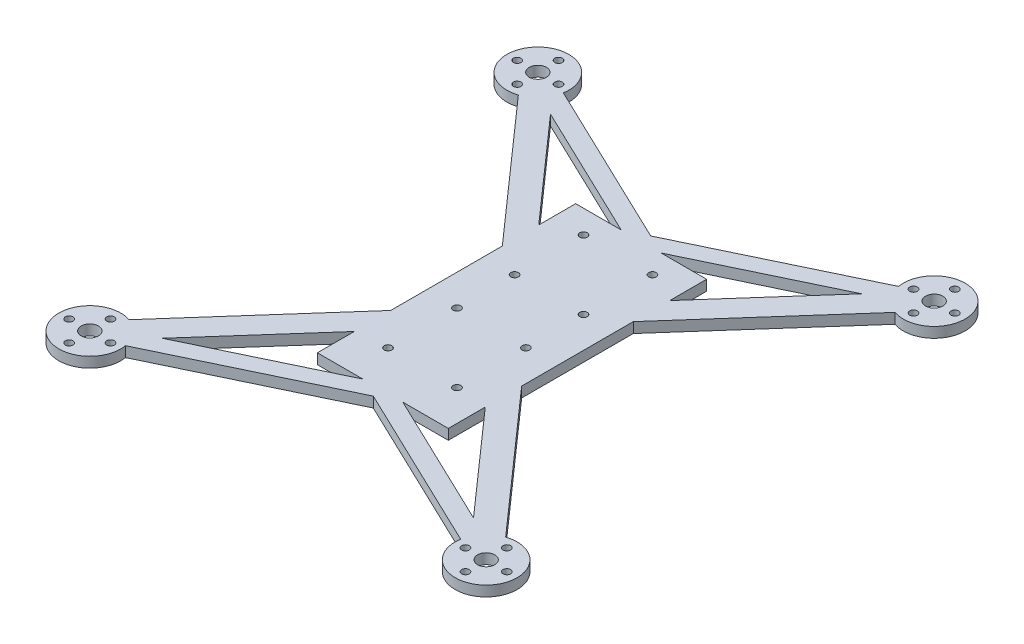
from build123d import *

# Parameters (mm, degrees)
SKETCH1_R           = 9
SKETCH1_R_2         = 1.1
SKETCH1_R_3         = 2.5
SKETCH1_W           = 38
SKETCH1_H           = 74.95
BOSS_EXTRUDE1_DEPTH = 3


with BuildPart() as part:
    # Sketch1 → Boss-Extrude1 (new body)
    # profile 1 of 13: a face of its own
    with BuildSketch(Plane(origin=(0, 0, 0), x_dir=(1, 0, 0), z_dir=(0, 1, 0))):
        with Locations((-57.5, 65)):
            Circle(SKETCH1_R)
        with Locations((-57.5, 71)):
            Circle(SKETCH1_R_2, mode=Mode.SUBTRACT)
        with Locations((-63.5, 65)):
            Circle(SKETCH1_R_2, mode=Mode.SUBTRACT)
        with Locations((-57.5, 59)):
            Circle(SKETCH1_R_2, mode=Mode.SUBTRACT)
        with Locations((-51.5, 65)):
            Circle(SKETCH1_R_2, mode=Mode.SUBTRACT)
        with Locations((-57.5, 65)):
            Circle(SKETCH1_R_3, mode=Mode.SUBTRACT)
    # profile 2 of 13: a face of its own
    with BuildSketch(Plane(origin=(0, 0, 0), x_dir=(1, 0, 0), z_dir=(0, 1, 0))):
        with Locations((57.5, 65)):
            Circle(SKETCH1_R)
        with Locations((57.5, 59)):
            Circle(SKETCH1_R_2, mode=Mode.SUBTRACT)
        with Locations((51.5, 65)):
            Circle(SKETCH1_R_2, mode=Mode.SUBTRACT)
        with Locations((57.5, 71)):
            Circle(SKETCH1_R_2, mode=Mode.SUBTRACT)
        with Locations((63.5, 65)):
            Circle(SKETCH1_R_2, mode=Mode.SUBTRACT)
        with Locations((57.5, 65)):
            Circle(SKETCH1_R_3, mode=Mode.SUBTRACT)
    # profile 3 of 13: a face of its own
    with BuildSketch(Plane(origin=(0, 0, 0), x_dir=(1, 0, 0), z_dir=(0, 1, 0))):
        with Locations((57.5, -65)):
            Circle(SKETCH1_R)
        with Locations((51.5, -65)):
            Circle(SKETCH1_R_2, mode=Mode.SUBTRACT)
        with Locations((57.5, -59)):
            Circle(SKETCH1_R_2, mode=Mode.SUBTRACT)
        with Locations((63.5, -65)):
            Circle(SKETCH1_R_2, mode=Mode.SUBTRACT)
        with Locations((57.5, -71)):
            Circle(SKETCH1_R_2, mode=Mode.SUBTRACT)
        with Locations((57.5, -65)):
            Circle(SKETCH1_R_3, mode=Mode.SUBTRACT)
    # profile 4 of 13: a face of its own
    with BuildSketch(Plane(origin=(0, 0, 0), x_dir=(1, 0, 0), z_dir=(0, 1, 0))):
        with Locations((-57.5, -65)):
            Circle(SKETCH1_R)
        with Locations((-57.5, -59)):
            Circle(SKETCH1_R_2, mode=Mode.SUBTRACT)
        with Locations((-51.5, -65)):
            Circle(SKETCH1_R_2, mode=Mode.SUBTRACT)
        with Locations((-57.5, -71)):
            Circle(SKETCH1_R_2, mode=Mode.SUBTRACT)
        with Locations((-63.5, -65)):
            Circle(SKETCH1_R_2, mode=Mode.SUBTRACT)
        with Locations((-57.5, -65)):
            Circle(SKETCH1_R_3, mode=Mode.SUBTRACT)
    # profile 5 of 13: a face of its own
    with BuildSketch(Plane(origin=(0, 0, 0), x_dir=(1, 0, 0), z_dir=(0, 1, 0))):
        Rectangle(SKETCH1_W, SKETCH1_H)
        with Locations((-10, 30.75)):
            Circle(SKETCH1_R_2, mode=Mode.SUBTRACT)
        with Locations((10, 30.75)):
            Circle(SKETCH1_R_2, mode=Mode.SUBTRACT)
        with Locations((10, 10.75)):
            Circle(SKETCH1_R_2, mode=Mode.SUBTRACT)
        with Locations((-10, 10.75)):
            Circle(SKETCH1_R_2, mode=Mode.SUBTRACT)
        with Locations((-10, -5.975)):
            Circle(SKETCH1_R_2, mode=Mode.SUBTRACT)
        with Locations((10, -5.975)):
            Circle(SKETCH1_R_2, mode=Mode.SUBTRACT)
        with Locations((10, -25.975)):
            Circle(SKETCH1_R_2, mode=Mode.SUBTRACT)
        with Locations((-10, -25.975)):
            Circle(SKETCH1_R_2, mode=Mode.SUBTRACT)
    # profile 6 of 13: a face of its own
    with BuildSketch(Plane(origin=(0, 0, 0), x_dir=(1, 0, 0), z_dir=(0, 1, 0))):
        Polygon((-19, 16.1958311), (-54.627715561, 56.470639995), (-49.384739623, 61.10865717), (-13.757024063, 20.833848275), align=None)
    # profile 7 of 13: a face of its own
    with BuildSketch(Plane(origin=(0, 0, 0), x_dir=(1, 0, 0), z_dir=(0, 1, 0))):
        Polygon((-50.781077312, 59.012005518), (3.631184446, 32.965092389), (5.790057611, 37.475), (-48.622204147, 63.521913129), align=None)
    # profile 8 of 13: a face of its own
    with BuildSketch(Plane(origin=(0, 0, 0), x_dir=(1, 0, 0), z_dir=(0, 1, 0))):
        Polygon((50.781077312, 59.012005518), (48.622204147, 63.521913129), (-5.790057611, 37.475), (-3.631184446, 32.965092389), align=None)
    # profile 9 of 13: a face of its own
    with BuildSketch(Plane(origin=(0, 0, 0), x_dir=(1, 0, 0), z_dir=(0, 1, 0))):
        Polygon((19, 16.1958311), (13.757024063, 20.833848275), (49.384739623, 61.10865717), (54.627715561, 56.470639995), align=None)
    # profile 10 of 13: a face of its own
    with BuildSketch(Plane(origin=(0, 0, 0), x_dir=(1, 0, 0), z_dir=(0, 1, 0))):
        Polygon((19, -16.1958311), (13.757024063, -20.833848275), (49.384739623, -61.10865717), (54.627715561, -56.470639995), align=None)
    # profile 11 of 13: a face of its own
    with BuildSketch(Plane(origin=(0, 0, 0), x_dir=(1, 0, 0), z_dir=(0, 1, 0))):
        Polygon((50.781077312, -59.012005518), (48.622204147, -63.521913129), (-5.790057611, -37.475), (-3.631184446, -32.965092389), align=None)
    # profile 12 of 13: a face of its own
    with BuildSketch(Plane(origin=(0, 0, 0), x_dir=(1, 0, 0), z_dir=(0, 1, 0))):
        Polygon((-50.781077312, -59.012005518), (-48.622204147, -63.521913129), (5.790057611, -37.475), (3.631184446, -32.965092389), align=None)
    # profile 13 of 13: a face of its own
    with BuildSketch(Plane(origin=(0, 0, 0), x_dir=(1, 0, 0), z_dir=(0, 1, 0))):
        Polygon((-19, -16.1958311), (-13.757024063, -20.833848275), (-49.384739623, -61.10865717), (-54.627715561, -56.470639995), align=None)
    extrude(amount=BOSS_EXTRUDE1_DEPTH)


solid = part.part
